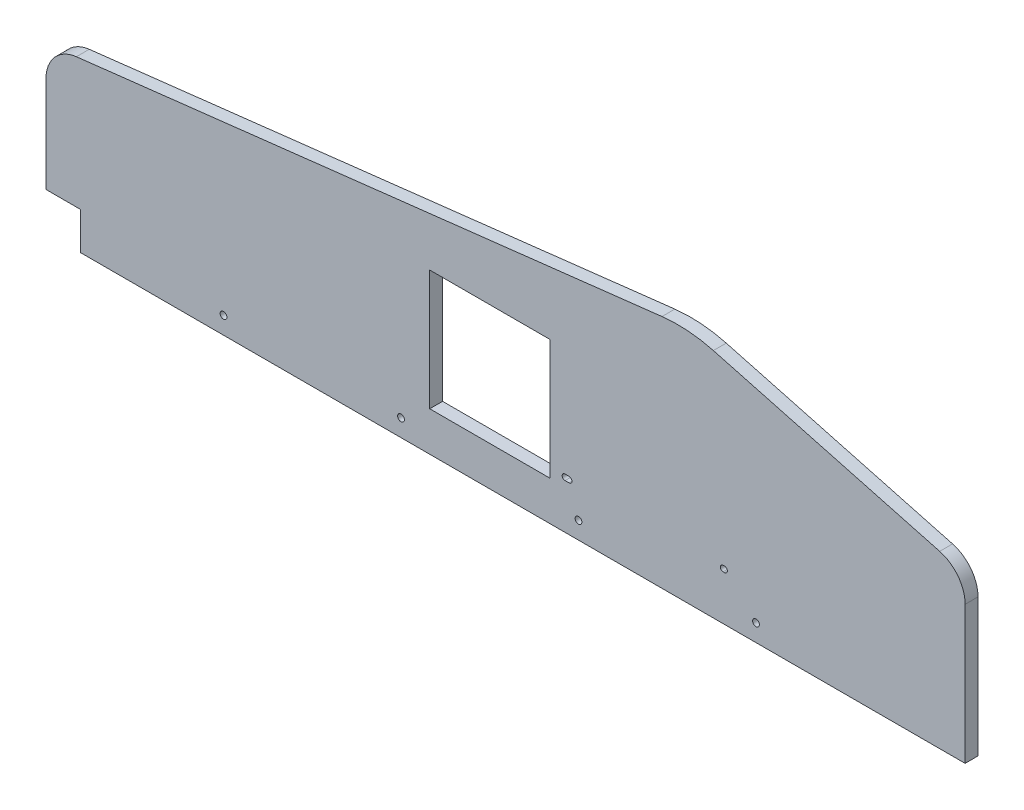
from build123d import *

# Parameters (mm, degrees)
BOSS_EXTRUDE1_DEPTH         = 4.7625
FILLET1_R                   = 25.4
FILLET2_R                   = 101.6
SKETCH3_W                   = 25.4
SKETCH3_H                   = 27.686
CUT_EXTRUDE1_DEPTH          = 383.440406717
SKETCH5_W                   = 88.9
SKETCH5_H                   = 88.9
CUT_EXTRUDE2_DEPTH          = 383.440406717
TAP_DRILL_FOR_M6X1_0_TAP1_D = 5
CUT_EXTRUDE3_DEPTH          = 383.440406717


with BuildPart() as part:
    # Sketch2 → Boss-Extrude1 (new, symmetric)
    with BuildSketch(Plane.XY):
        Polygon((-340, 26.400000032), (-340, 121.400000032), (135, 176.400000032), (340, 121.400000032), (340, 26.400000032), (340, 0), (-340, 0), align=None)
    extrude(amount=BOSS_EXTRUDE1_DEPTH, both=True)

    # Fillet1
    fillet1_edges = [part.edges().sort_by_distance(p)[0] for p in [
        (340, 121.400000032, 0),
        (-340, 121.400000032, 0),
    ]]
    fillet(fillet1_edges, radius=FILLET1_R)

    # Fillet2
    fillet2_edges = [part.edges().sort_by_distance(p)[0] for p in [
        (135, 176.400000032, 0),
    ]]
    fillet(fillet2_edges, radius=FILLET2_R)

    # Sketch3 → Cut-Extrude1 (cut, through all)
    with BuildSketch(Plane.XY.offset(4.7625)):
        with Locations((-327.3, 13.843)):
            Rectangle(SKETCH3_W, SKETCH3_H)
    extrude(amount=-CUT_EXTRUDE1_DEPTH, mode=Mode.SUBTRACT)

    # Sketch5 → Cut-Extrude2 (cut, through all)
    with BuildSketch(Plane.XY.offset(4.7625)):
        with Locations((-11.668485666, 73.596499999)):
            Rectangle(SKETCH5_W, SKETCH5_H)
    extrude(amount=-CUT_EXTRUDE2_DEPTH, mode=Mode.SUBTRACT)

    # Tap Drill for M6x1.0 Tap1 (through all)
    with Locations(Plane.XY.offset(4.7625)):
        with Locations((-208.682, 12.7), (-77.364, 12.7), (53.954, 12.7), (185.272, 12.7)):
            Hole(TAP_DRILL_FOR_M6X1_0_TAP1_D / 2)

    # Sketch8 → Cut-Extrude3 (cut, through all)
    with BuildSketch(Plane.XY.offset(4.7625)):
        with BuildLine():
            Line((161, 37.4), (162, 37.4))
            ThreePointArc((162, 37.4), (164.1, 35.3), (162, 33.2))
            Line((162, 33.2), (161, 33.2))
            ThreePointArc((161, 33.2), (158.9, 35.3), (161, 37.4))
        make_face()
        with BuildLine():
            Line((47, 33.2), (44, 33.2))
            ThreePointArc((44, 33.2), (41.9, 35.3), (44, 37.4))
            Line((44, 37.4), (47, 37.4))
            ThreePointArc((47, 37.4), (49.1, 35.3), (47, 33.2))
        make_face()
    extrude(amount=-CUT_EXTRUDE3_DEPTH, mode=Mode.SUBTRACT)


solid = part.part
